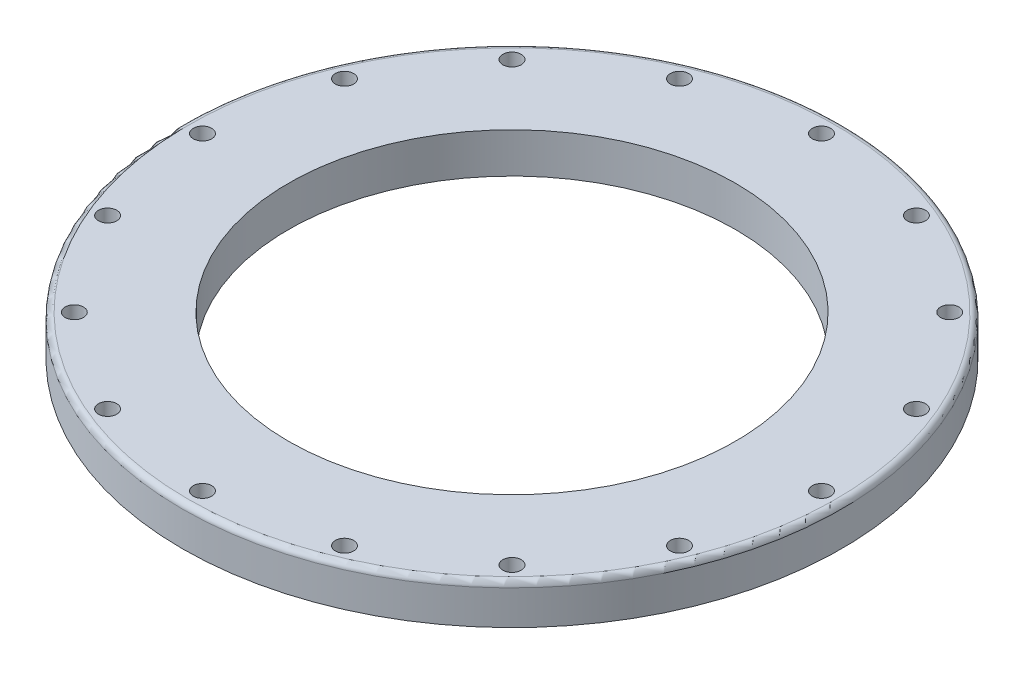
from build123d import *

# Parameters (mm, degrees)
SKETCH1_R           = 57.5
SKETCH1_R_2         = 39
BOSS_EXTRUDE1_DEPTH = 7
SKETCH2_R           = 1.6
CUT_EXTRUDE1_DEPTH  = 25
FILLET1_R           = 1


with BuildPart() as part:
    # Sketch1 → Boss-Extrude1 (new body)
    with BuildSketch(Plane(origin=(0, 0, 0), x_dir=(1, 0, 0), z_dir=(0, 1, 0))):
        Circle(SKETCH1_R)
        Circle(SKETCH1_R_2, mode=Mode.SUBTRACT)
    extrude(amount=BOSS_EXTRUDE1_DEPTH)

    # Sketch2 → Cut-Extrude1 (cut)
    with BuildSketch(Plane(origin=(0, 7, 0), x_dir=(1, 0, 0), z_dir=(0, 1, 0))):
        with Locations((0, 54)):
            Circle(SKETCH2_R)
        with Locations((20.664905348, 49.889494756)):
            Circle(SKETCH2_R)
        with Locations((38.183766184, 38.183766184)):
            Circle(SKETCH2_R)
        with Locations((49.889494756, 20.664905348)):
            Circle(SKETCH2_R)
        with Locations((54, 0)):
            Circle(SKETCH2_R)
        with Locations((49.889494756, -20.664905348)):
            Circle(SKETCH2_R)
        with Locations((38.183766184, -38.183766184)):
            Circle(SKETCH2_R)
        with Locations((20.664905348, -49.889494756)):
            Circle(SKETCH2_R)
        with Locations((0, -54)):
            Circle(SKETCH2_R)
        with Locations((-20.664905348, -49.889494756)):
            Circle(SKETCH2_R)
        with Locations((-38.183766184, -38.183766184)):
            Circle(SKETCH2_R)
        with Locations((-49.889494756, -20.664905348)):
            Circle(SKETCH2_R)
        with Locations((-54, 0)):
            Circle(SKETCH2_R)
        with Locations((-49.889494756, 20.664905348)):
            Circle(SKETCH2_R)
        with Locations((-38.183766184, 38.183766184)):
            Circle(SKETCH2_R)
        with Locations((-20.664905348, 49.889494756)):
            Circle(SKETCH2_R)
    extrude(amount=-CUT_EXTRUDE1_DEPTH, mode=Mode.SUBTRACT)

    # Fillet1
    fillet1_edges = [part.edges().sort_by_distance(p)[0] for p in [
        (-57.5, 7, 0),
    ]]
    fillet(fillet1_edges, radius=FILLET1_R)


solid = part.part
